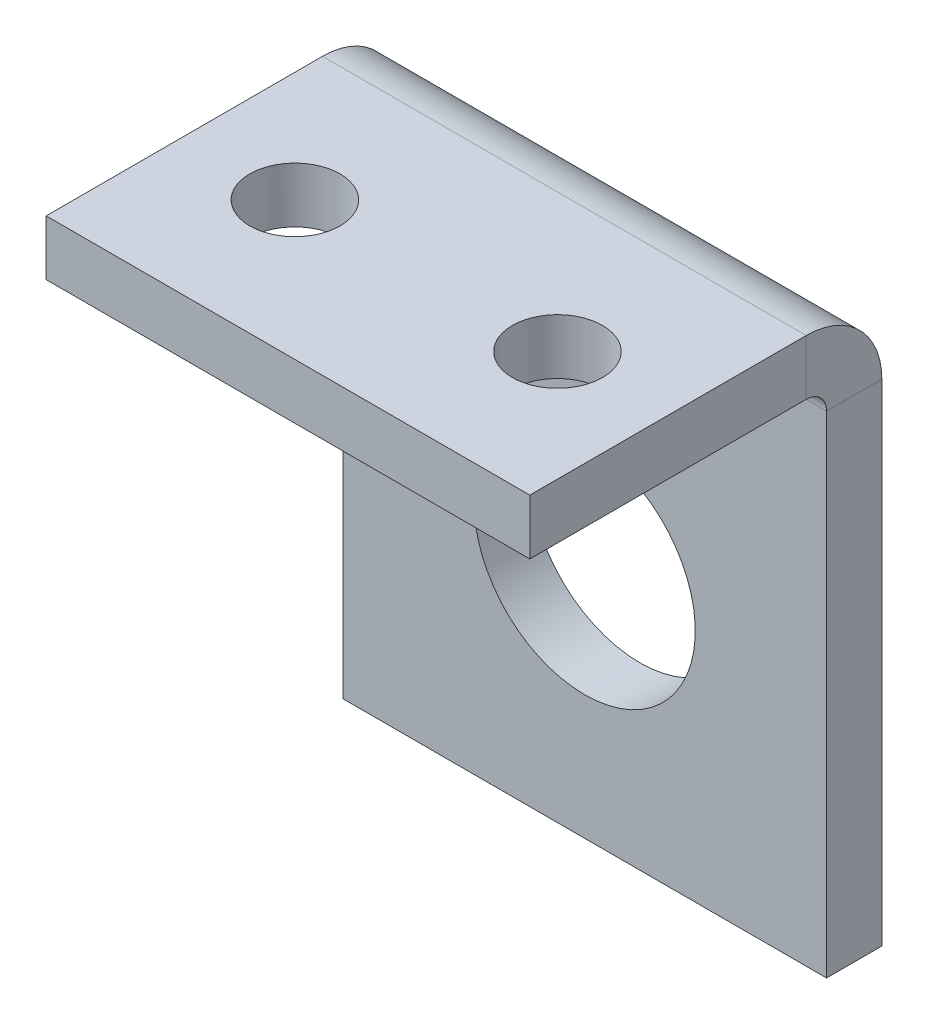
from build123d import *

# Parameters (mm, degrees)
SKETCH1_W                 = 17.5
SKETCH1_H                 = 10
BASE_FLANGE1_DEPTH        = 2
F_4_CLEARANCE_HOLE1_D     = 3.2639
F_4_CLEARANCE_HOLE1_DEPTH = 2
F_4_CLEARANCE_HOLE1_TIP   = 0.980574487
EDGE_FLANGE1_DEPTH        = 17.5
SKETCH20_R                = 4
CUT_EXTRUDE1_DEPTH        = 2


# Sheet-metal steps are written as plain solids
with BuildPart() as part:
    # Sketch1 → Base-Flange1 (new body)
    with BuildSketch(Plane(origin=(0, 0, 0), x_dir=(1, 0, 0), z_dir=(0, 1, 0))):
        with Locations((-14.536713287, 16.32983683)):
            Rectangle(SKETCH1_W, SKETCH1_H)
    extrude(amount=-BASE_FLANGE1_DEPTH)

    # #4 Clearance Hole1
    with Locations(Plane.XZ.offset(2)):
        with Locations((-9.786713287, -16.32983683), (-19.286713287, -16.32983683)):
            Hole(F_4_CLEARANCE_HOLE1_D / 2, depth=F_4_CLEARANCE_HOLE1_DEPTH)
            with Locations((0, 0, -(F_4_CLEARANCE_HOLE1_DEPTH + F_4_CLEARANCE_HOLE1_TIP / 2))):  # 118° drill point
                Cone(0, F_4_CLEARANCE_HOLE1_D / 2, F_4_CLEARANCE_HOLE1_TIP, mode=Mode.SUBTRACT)

    # Edge-Flange1 section (across the edge) → Edge-Flange1 (add)
    with BuildSketch(Plane(origin=(-23.286713287, -2, -22.06643683), x_dir=(0, 0, 1), z_dir=(1, 0, 0))):
        with BuildLine():
            Line((-2, 0.7366), (-2, 18.5))
            Line((-2, 18.5), (0, 18.5))
            Line((0, 18.5), (0, 0.7366))
            ThreePointArc((0, 0.7366), (0.215745145, 0.215745145), (0.7366, 0))
            Line((0.7366, 0), (0.7366, -2))
            ThreePointArc((0.7366, -2), (-1.198468417, -1.198468417), (-2, 0.7366))
        make_face()
    extrude(amount=EDGE_FLANGE1_DEPTH)

    # Sketch20 → Cut-Extrude1 (cut)
    with BuildSketch(Plane(origin=(0, 0, -24.06643683), x_dir=(-1, 0, 0), z_dir=(0, 0, -1))):
        with Locations(Location((14.536713287, -12, 0), (0, 0, 90))):
            Circle(SKETCH20_R)
    extrude(amount=-CUT_EXTRUDE1_DEPTH, mode=Mode.SUBTRACT)


solid = part.part
